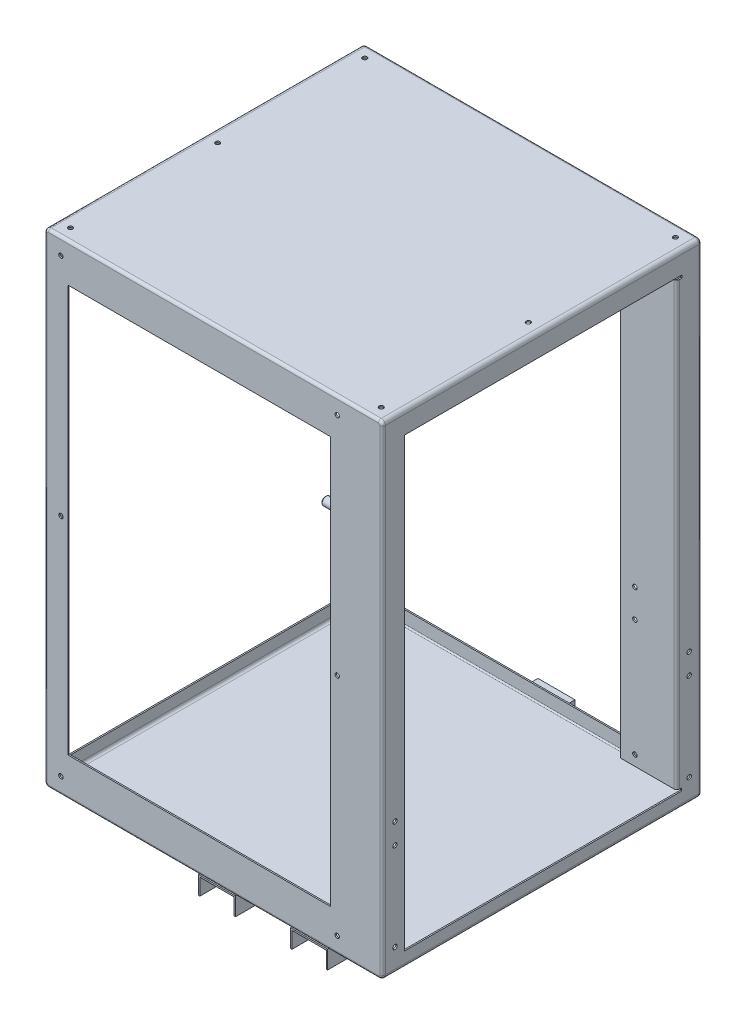
from build123d import *

# Parameters (mm, degrees)
EXTRUDE_1_DEPTH             = 232
SKETCH_2_W                  = 200
SKETCH_2_H                  = 325
CUT_EXTRUDE_1_DEPTH         = 500
EXTRUDE_START               = -1
EXTRUDE_1_2_DEPTH           = 1
SKETCH_4_W                  = 214
SKETCH_4_H                  = 325
EXTRUDE_2_DEPTH             = 1
FILLET_1_R                  = 1
FILLET_2_R                  = 2
SKETCH_6_R                  = 3
EXTRUDE_3_DEPTH             = 20
CHAMFER_1_SIZE              = 1
SKETCH_7_R                  = 1.6
CUT_EXTRUDE_3_DEPTH         = 500
SKETCH_8_W                  = 191
SKETCH_8_H                  = 296
CUT_EXTRUDE_4_DEPTH         = 2
SKETCH_9_R                  = 1.6
CUT_EXTRUDE_5_DEPTH         = 2
EXTRUDE_6_REACH             = 396.406
EXTRUDE_6_DIRECTION_2_DEPTH = 15
SKETCH_16_W                 = 1
SKETCH_16_H                 = 325
EXTRUDE_9_DEPTH             = 2
SKETCH_17_W                 = 1
SKETCH_17_H                 = 321
EXTRUDE_10_DEPTH            = 40
SKETCH_18_W                 = 1
SKETCH_18_H                 = 321
EXTRUDE_11_DEPTH            = 40
SKETCH_19_W                 = 3.5
SKETCH_19_H                 = 2
CUT_EXTRUDE_8_DEPTH         = 40
SKETCH_20_R                 = 1.6
CUT_EXTRUDE_9_DEPTH         = 10
FILLET_4_R                  = 2
SKETCH_22_W                 = 4.75100146
SKETCH_22_H                 = 2.010828375
SKETCH_22_W_2               = 3.5
SKETCH_22_H_2               = 2
CUT_EXTRUDE_11_DEPTH        = 10
SKETCH_23_R                 = 1.6
CUT_EXTRUDE_12_DEPTH        = 10


with BuildPart() as part:
    # Эскиз1 → Extrude 1 (new body)
    with BuildSketch(Plane.XY):
        with BuildLine():
            Line((123, -173), (123, 173))
            ThreePointArc((123, 173), (122.121320344, 175.121320344), (120, 176))
            Line((120, 176), (-120, 176))
            ThreePointArc((-120, 176), (-122.121320344, 175.121320344), (-123, 173))
            Line((-123, 173), (-123, -173))
            ThreePointArc((-123, -173), (-122.121320344, -175.121320344), (-120, -176))
            Line((-120, -176), (120, -176))
            ThreePointArc((120, -176), (122.121320344, -175.121320344), (123, -173))
        make_face()
        with BuildLine():
            Line((122, -173), (122, 173))
            ThreePointArc((122, 173), (121.414213562, 174.414213562), (120, 175))
            Line((120, 175), (-120, 175))
            ThreePointArc((-120, 175), (-121.414213562, 174.414213562), (-122, 173))
            Line((-122, 173), (-122, -173))
            ThreePointArc((-122, -173), (-121.414213562, -174.414213562), (-120, -175))
            Line((-120, -175), (120, -175))
            ThreePointArc((120, -175), (121.414213562, -174.414213562), (122, -173))
        make_face(mode=Mode.SUBTRACT)
    extrude(amount=EXTRUDE_1_DEPTH)

    # Эскиз2 → Вырез-Вытянуть1 (cut)
    with BuildSketch(Plane(origin=(123, 0, 0), x_dir=(0, 0, -1), z_dir=(1, 0, 0))):
        with Locations((-116, -2.5)):
            Rectangle(SKETCH_2_W, SKETCH_2_H)
    extrude(amount=-CUT_EXTRUDE_1_DEPTH, mode=Mode.SUBTRACT)

    # Эскиз3 → Extrude 1 2 (add)
    with BuildSketch(Plane.XY.offset(232).offset(EXTRUDE_START)):
        with BuildLine():
            Line((-123, 173), (-123, -173))
            ThreePointArc((-123, -173), (-122.121320344, -175.121320344), (-120, -176))
            Line((-120, -176), (120, -176))
            ThreePointArc((120, -176), (122.121320344, -175.121320344), (123, -173))
            Line((123, -173), (123, 173))
            ThreePointArc((123, 173), (122.121320344, 175.121320344), (120, 176))
            Line((120, 176), (-120, 176))
            ThreePointArc((-120, 176), (-122.121320344, 175.121320344), (-123, 173))
        make_face()
    extrude(amount=EXTRUDE_1_2_DEPTH)

    # Эскиз4 → Вытянуть2 (add)
    with BuildSketch(Plane(origin=(0, 0, 0), x_dir=(-1, 0, 0), z_dir=(0, 0, -1))):
        with BuildLine():
            Line((120, 176), (-120, 176))
            ThreePointArc((-120, 176), (-122.121320344, 175.121320344), (-123, 173))
            Line((-123, 173), (-123, -173))
            ThreePointArc((-123, -173), (-122.121320344, -175.121320344), (-120, -176))
            Line((-120, -176), (120, -176))
            ThreePointArc((120, -176), (122.121320344, -175.121320344), (123, -173))
            Line((123, -173), (123, 173))
            ThreePointArc((123, 173), (122.121320344, 175.121320344), (120, 176))
        make_face()
        with Locations((0, -2.5)):
            Rectangle(SKETCH_4_W, SKETCH_4_H, mode=Mode.SUBTRACT)
    extrude(amount=-EXTRUDE_2_DEPTH)

    # Скругление1
    fillet_1_edges = [part.edges().sort_by_distance(p)[0] for p in [
        (-122, 0, 1),
        (-121.414213562, 174.414213562, 1),
        (0, 175, 1),
        (121.414213562, 174.414213562, 1),
        (122, 0, 1),
        (121.414213562, -174.414213562, 1),
        (0, -175, 1),
        (-121.414213562, -174.414213562, 1),
        (0, 175, 231),
        (-121.414213562, 174.414213562, 231),
        (-122, 0, 231),
        (-121.414213562, -174.414213562, 231),
        (0, -175, 231),
        (121.414213562, -174.414213562, 231),
        (122, 0, 231),
        (121.414213562, 174.414213562, 231),
    ]]
    fillet(fillet_1_edges, radius=FILLET_1_R)

    # Скругление2
    fillet_2_edges = [part.edges().sort_by_distance(p)[0] for p in [
        (-122.121320344, -175.121320344, 232),
        (0, -176, 232),
        (122.121320344, -175.121320344, 232),
        (123, 0, 232),
        (122.121320344, 175.121320344, 232),
        (0, 176, 232),
        (-122.121320344, 175.121320344, 232),
        (0, 176, 0),
        (122.121320344, 175.121320344, 0),
        (123, 0, 0),
        (122.121320344, -175.121320344, 0),
        (0, -176, 0),
        (-122.121320344, -175.121320344, 0),
        (-123, 0, 0),
        (-122.121320344, 175.121320344, 0),
        (-123, 0, 232),
    ]]
    fillet(fillet_2_edges, radius=FILLET_2_R)

    # Эскиз6 → Вытянуть3 (add)
    with BuildSketch(Plane.ZY.offset(123)):
        with Locations(Location((8, -118, 0), (0, 0, 180))):
            Circle(SKETCH_6_R)
    extrude(amount=EXTRUDE_3_DEPTH)

    # Фаска1
    chamfer_1_edges = [part.edges().sort_by_distance(p)[0] for p in [
        (-143, -118, 11),
    ]]
    chamfer(chamfer_1_edges, length=CHAMFER_1_SIZE)

    # Эскиз7 → Вырез-Вытянуть3 (cut)
    with BuildSketch(Plane.ZY.offset(123)):
        with Locations((9, -95)):
            Circle(SKETCH_7_R)
        with Locations((9, -159)):
            Circle(SKETCH_7_R)
        with Locations((223, -95)):
            Circle(SKETCH_7_R)
        with Locations((223, -159)):
            Circle(SKETCH_7_R)
        with Locations((9, -80)):
            Circle(SKETCH_7_R)
        with Locations((223, -80)):
            Circle(SKETCH_7_R)
    extrude(amount=-CUT_EXTRUDE_3_DEPTH, mode=Mode.SUBTRACT)

    # Эскиз8 → Вырез-Вытянуть4 (cut)
    with BuildSketch(Plane.XY.offset(232)):
        with Locations((-10.5, 0)):
            Rectangle(SKETCH_8_W, SKETCH_8_H)
    extrude(amount=-CUT_EXTRUDE_4_DEPTH, mode=Mode.SUBTRACT)

    # Эскиз9 → Вырез-Вытянуть5 (cut)
    with BuildSketch(Plane.XY.offset(232)):
        with Locations((-111, 164)):
            Circle(SKETCH_9_R)
        with Locations((-111, 0)):
            Circle(SKETCH_9_R)
        with Locations((-111, -164)):
            Circle(SKETCH_9_R)
        with Locations((90, -164)):
            Circle(SKETCH_9_R)
        with Locations((90, 0)):
            Circle(SKETCH_9_R)
        with Locations((90, 164)):
            Circle(SKETCH_9_R)
    extrude(amount=-CUT_EXTRUDE_5_DEPTH, mode=Mode.SUBTRACT)

    # Вытянуть6: up to this face of the body (flat: up to its plane)
    extrude_6_end = Plane(part.part.faces().sort_by_distance((-117.709874725, -170.709874725, 232))[0])
    # Эскиз10 → Вытянуть6 (add, up to the picked face)
    with BuildSketch(Plane(origin=(123, 0, 0), x_dir=(1, 0, 0), z_dir=(0, 0, 1)), mode=Mode.PRIVATE) as extrude_6_sk1:
        Polygon((-134, -176.015230639), (-134, -175.815230639), (-107, -175.815230639), (-107, -176.015230639), (-107, -189.015230639), (-108, -189.015230639), (-108, -177.015230639), (-133, -177.015230639), (-133, -189.015230639), (-134, -189.015230639), align=None)
    extrude_6_tool1 = split(extrude(extrude_6_sk1.sketch, amount=EXTRUDE_6_REACH, mode=Mode.PRIVATE), bisect_by=extrude_6_end, keep=Keep.BOTH, mode=Mode.PRIVATE)
    # Эскиз10 → Вытянуть6 (add, up to the picked face)
    with BuildSketch(Plane(origin=(123, 0, 0), x_dir=(1, 0, 0), z_dir=(0, 0, 1)), mode=Mode.PRIVATE) as extrude_6_sk2:
        Polygon((-67, -176.015230639), (-67, -175.815230639), (-40, -175.815230639), (-40, -176.015230639), (-40, -189.015230639), (-41, -189.015230639), (-41, -177.015230639), (-66, -177.015230639), (-66, -189.015230639), (-67, -189.015230639), align=None)
    extrude_6_tool2 = split(extrude(extrude_6_sk2.sketch, amount=EXTRUDE_6_REACH, mode=Mode.PRIVATE), bisect_by=extrude_6_end, keep=Keep.BOTH, mode=Mode.PRIVATE)
    add(extrude_6_tool1.solids().sort_by(Axis((-10.69946, -175.915231, 0), (0, 0, 1)))[0])
    add(extrude_6_tool2.solids().sort_by(Axis((56.30054, -175.915231, 0), (0, 0, 1)))[0])

    # Эскиз10 → Вытянуть6 direction 2 (add)
    with BuildSketch(Plane(origin=(123, 0, 0), x_dir=(1, 0, 0), z_dir=(0, 0, 1))):
        Polygon((-134, -176.015230639), (-134, -175.815230639), (-107, -175.815230639), (-107, -176.015230639), (-107, -189.015230639), (-108, -189.015230639), (-108, -177.015230639), (-133, -177.015230639), (-133, -189.015230639), (-134, -189.015230639), align=None)
        Polygon((-67, -176.015230639), (-67, -175.815230639), (-40, -175.815230639), (-40, -176.015230639), (-40, -189.015230639), (-41, -189.015230639), (-41, -177.015230639), (-66, -177.015230639), (-66, -189.015230639), (-67, -189.015230639), align=None)
    extrude(amount=-EXTRUDE_6_DIRECTION_2_DEPTH)

    # Эскиз16 → Вытянуть9 (add)
    with BuildSketch(Plane.XY.offset(16)):
        with Locations((122.5, -2.5)):
            Rectangle(SKETCH_16_W, SKETCH_16_H)
        with Locations((-122.5, -2.5)):
            Rectangle(SKETCH_16_W, SKETCH_16_H)
    extrude(amount=EXTRUDE_9_DEPTH)

    # Эскиз17 → Вытянуть10 (add)
    with BuildSketch(Plane.ZY.offset(-122)):
        with Locations((17.5, -2.5)):
            Rectangle(SKETCH_17_W, SKETCH_17_H)
    extrude(amount=EXTRUDE_10_DEPTH)

    # Эскиз18 → Вытянуть11 (add)
    with BuildSketch(Plane(origin=(-122, 0, 0), x_dir=(0, 0, -1), z_dir=(1, 0, 0))):
        with Locations((-17.5, -2.5)):
            Rectangle(SKETCH_18_W, SKETCH_18_H)
    extrude(amount=EXTRUDE_11_DEPTH)

    # Эскиз19 → Вырез-Вытянуть8 (cut)
    with BuildSketch(Plane(origin=(-122, 0, 0), x_dir=(0, 0, -1), z_dir=(1, 0, 0))):
        with Locations((-16.25, -164)):
            Rectangle(SKETCH_19_W, SKETCH_19_H)
        with Locations((-16.25, 159)):
            Rectangle(SKETCH_19_W, SKETCH_19_H)
    extrude(amount=-CUT_EXTRUDE_8_DEPTH, mode=Mode.SUBTRACT)

    # Эскиз20 → Вырез-Вытянуть9 (cut)
    with BuildSketch(Plane(origin=(0, 0, 17), x_dir=(-1, 0, 0), z_dir=(0, 0, -1))):
        with Locations((-92.5, 145.5)):
            Circle(SKETCH_20_R)
        with Locations((-92.5, -50)):
            Circle(SKETCH_20_R)
        with Locations((-92.5, -155.5)):
            Circle(SKETCH_20_R)
        with Locations(Location((92.5, -155.5, 0), (0, 0, 180))):
            Circle(SKETCH_20_R)
        with Locations(Location((92.5, -50, 0), (0, 0, 180))):
            Circle(SKETCH_20_R)
        with Locations(Location((92.5, 145.5, 0), (0, 0, 180))):
            Circle(SKETCH_20_R)
        with Locations((-92.5, -70.5)):
            Circle(SKETCH_20_R)
        with Locations(Location((92.5, -70.5, 0), (0, 0, 180))):
            Circle(SKETCH_20_R)
    extrude(amount=-CUT_EXTRUDE_9_DEPTH, mode=Mode.SUBTRACT)

    # Скругление4
    # the kernel refuses this fillet: 2 mm, written as the material it takes off along each edge
    with BuildSketch(Plane(origin=(122, -165, 216), x_dir=(1, 0, 0), z_dir=(0, 1, 0)), Plane(origin=(-122, 160, 216), x_dir=(-1, 0, 0), z_dir=(0, -1, 0))) as fillet_4_piece_1:
        with BuildLine():
            CenterArc((2, -1.732050808), FILLET_4_R, 120, 60)
            Line((0, -1.732050808), (0, 0))
            Line((0, 0), (1, 0))
        make_face()
    extrude(amount=325, mode=Mode.SUBTRACT)
    with BuildSketch(Plane(origin=(123, -165, 18), x_dir=(0, 0, -1), z_dir=(0, 1, 0))) as fillet_4_piece_2:
        with BuildLine():
            CenterArc((FILLET_4_R, FILLET_4_R), FILLET_4_R, 180, 90)
            Line((0, FILLET_4_R), (0, 0))
            Line((0, 0), (FILLET_4_R, 0))
        make_face()
    extrude(amount=325, mode=Mode.SUBTRACT)
    with BuildSketch(Plane(origin=(-123, 158, 18), x_dir=(0, 0, -1), z_dir=(0, -1, 0))) as fillet_4_piece_3_section:
        with BuildLine():
            CenterArc((FILLET_4_R, FILLET_4_R), FILLET_4_R, 180, 90)
            Line((0, FILLET_4_R), (0, 0))
            Line((0, 0), (FILLET_4_R, 0))
        make_face()
    fillet_4_piece_3 = extrude(amount=326, mode=Mode.PRIVATE)
    fillet_4_piece_3 = split(fillet_4_piece_3, bisect_by=Plane(origin=(-122.64320814, -165, 17.511950301), z_dir=(0, 1, 0)), keep=Keep.TOP, mode=Mode.PRIVATE)
    add(fillet_4_piece_3, mode=Mode.SUBTRACT)

    # Эскиз22 → Вырез-Вытянуть11 (cut)
    with BuildSketch(Plane.ZY.offset(-122)):
        with Locations((16.87550073, -163.994585813)):
            Rectangle(SKETCH_22_W, SKETCH_22_H)
        with Locations((15.982050808, 159)):
            Rectangle(SKETCH_22_W_2, SKETCH_22_H_2)
    extrude(amount=-CUT_EXTRUDE_11_DEPTH, mode=Mode.SUBTRACT)

    # Эскиз23 → Вырез-Вытянуть12 (cut)
    with BuildSketch(Plane(origin=(0, 176, 0), x_dir=(1, 0, 0), z_dir=(0, 1, 0))):
        with Locations(Location((-113, -223, 0), (0, 0, 270))):
            Circle(SKETCH_23_R)
        with Locations(Location((-113, -116, 0), (0, 0, 270))):
            Circle(SKETCH_23_R)
        with Locations(Location((-113, -9, 0), (0, 0, 270))):
            Circle(SKETCH_23_R)
        with Locations(Location((113, -223, 0), (0, 0, 90))):
            Circle(SKETCH_23_R)
        with Locations(Location((113, -116, 0), (0, 0, 90))):
            Circle(SKETCH_23_R)
        with Locations(Location((113, -9, 0), (0, 0, 90))):
            Circle(SKETCH_23_R)
    extrude(amount=-CUT_EXTRUDE_12_DEPTH, mode=Mode.SUBTRACT)


solid = part.part
